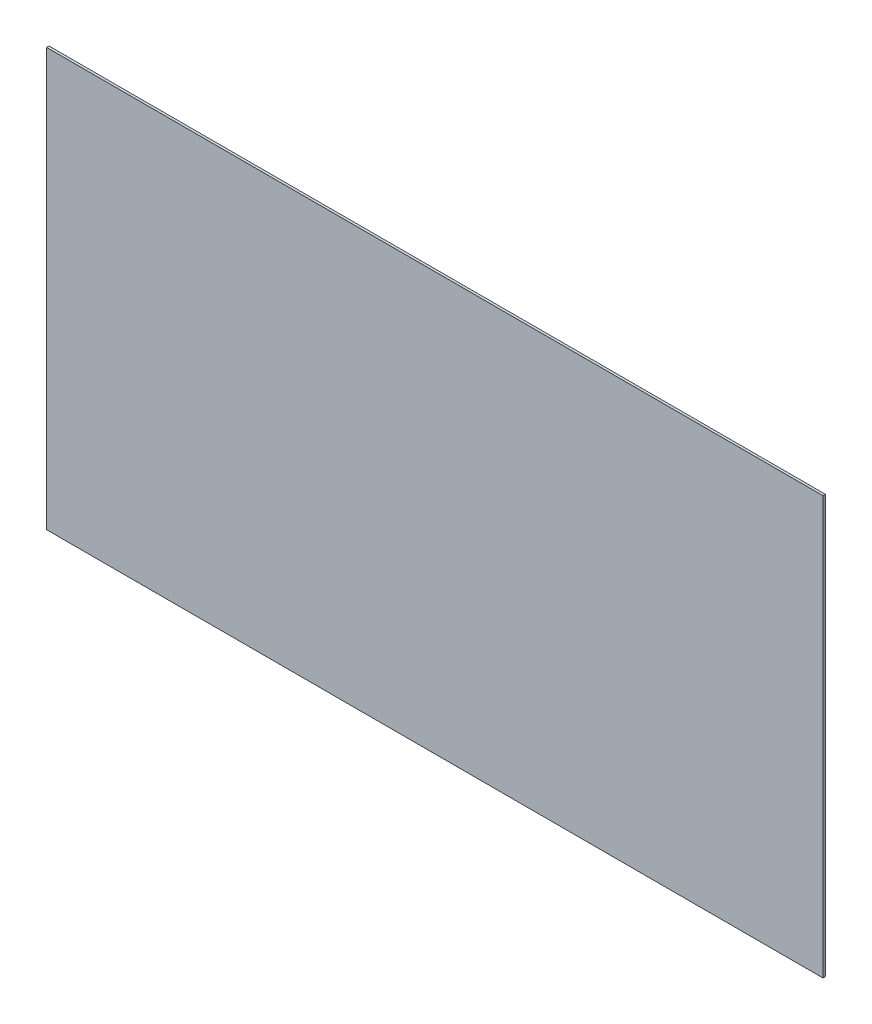
from build123d import *

# Parameters (mm, degrees)
SKETCH1_W           = 1003.3
SKETCH1_H           = 539.75
BOSS_EXTRUDE1_DEPTH = 3.175


with BuildPart() as part:
    # Sketch1 → Boss-Extrude1 (new body)
    with BuildSketch(Plane.XY):
        with Locations((501.65, 269.875)):
            Rectangle(SKETCH1_W, SKETCH1_H)
    extrude(amount=BOSS_EXTRUDE1_DEPTH)


solid = part.part
